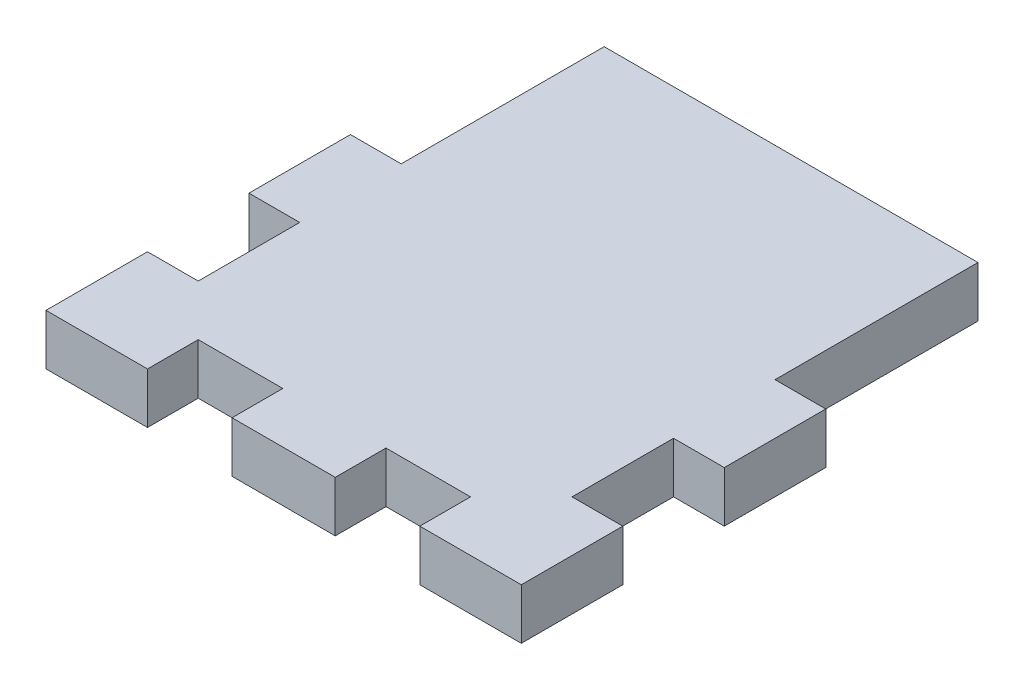
from build123d import *

# Parameters (mm, degrees)
PAREDELADO2_DEPTH = 3


with BuildPart() as part:
    # ParedeLado2Esboco → ParedeLado2 (new body)
    with BuildSketch(Plane(origin=(0, 0, 0), x_dir=(1, 0, 0), z_dir=(0, 1, 0))):
        Polygon((0, 0), (0, 6), (3, 6), (3, 12), (0, 12), (0, 18), (3, 18), (3, 30), (25.1, 30), (25.1, 18), (28.1, 18), (28.1, 12), (25.1, 12), (25.1, 6), (28.1, 6), (28.1, 0), (22.1, 0), (22.1, 3), (17.1, 3), (17.1, 0), (11, 0), (11, 3), (6, 3), (6, 0), align=None)
    extrude(amount=PAREDELADO2_DEPTH)


solid = part.part
